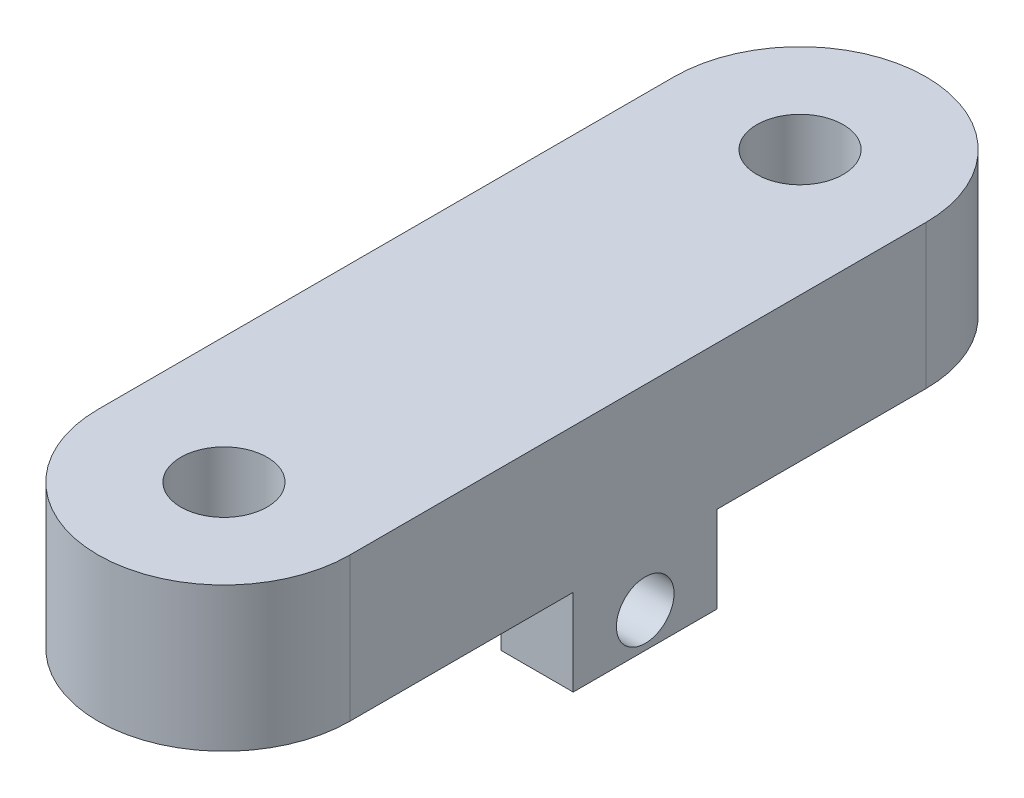
from build123d import *

# Parameters (mm, degrees)
SKETCH1_W             = 5
SKETCH1_H             = 10
BOSS_EXTRUDE1_DEPTH   = 6
BOSS_EXTRUDE1_2_DEPTH = 6
SKETCH2_R             = 2
CUT_EXTRUDE1_DEPTH    = 100
SKETCH4_R             = 3
BOSS_EXTRUDE2_DEPTH   = 10


with BuildPart() as part:
    # Sketch1 → Boss-Extrude1 (new body)
    with BuildSketch(Plane(origin=(0, 0, 0), x_dir=(1, 0, 0), z_dir=(0, 1, 0))):
        with Locations((-15, 5)):
            Rectangle(SKETCH1_W, SKETCH1_H)
    extrude(amount=BOSS_EXTRUDE1_DEPTH)


with BuildPart() as body_2:
    # Sketch1 → Boss-Extrude1 2 (new body)
    with BuildSketch(Plane(origin=(0, 0, 0), x_dir=(1, 0, 0), z_dir=(0, 1, 0))):
        with Locations((-2.5, 5)):
            Rectangle(SKETCH1_W, SKETCH1_H)
    extrude(amount=BOSS_EXTRUDE1_2_DEPTH)


with BuildPart() as cut_extrude1_tool:
    # Sketch2 → Cut-Extrude1 (new body)
    with BuildSketch(Plane(origin=(0, 0, 0), x_dir=(0, 0, -1), z_dir=(1, 0, 0))):
        with Locations((5, 2.43)):
            Circle(SKETCH2_R)
    extrude(amount=-CUT_EXTRUDE1_DEPTH)


with BuildPart() as part_1:
    add(part.part)

    # Cut-Extrude1: cut by cut_extrude1_tool
    add(cut_extrude1_tool.part, mode=Mode.SUBTRACT)



with BuildPart() as body_2_1:
    add(body_2.part)

    # Cut-Extrude1: cut by cut_extrude1_tool
    add(cut_extrude1_tool.part, mode=Mode.SUBTRACT)


with BuildPart() as part_2:
    add(part_1.part)

    add(body_2_1.part)  # Boss-Extrude2 merges body 2
    # Sketch4 → Boss-Extrude2 (add)
    with BuildSketch(Plane(origin=(0, 6, 0), x_dir=(1, 0, 0), z_dir=(0, 1, 0))):
        with BuildLine():
            Line((-17.5, -15.5), (-17.5, 24.5))
            ThreePointArc((-17.5, 24.5), (-8.75, 33.25), (0, 24.5))
            Line((0, 24.5), (0, -15.5))
            ThreePointArc((0, -15.5), (-8.75, -24.25), (-17.5, -15.5))
        make_face()
        with Locations((-8.75, 24.5)):
            Circle(SKETCH4_R, mode=Mode.SUBTRACT)
        with Locations((-8.75, -15.5)):
            Circle(SKETCH4_R, mode=Mode.SUBTRACT)
    extrude(amount=BOSS_EXTRUDE2_DEPTH)


solid = part_2.part
